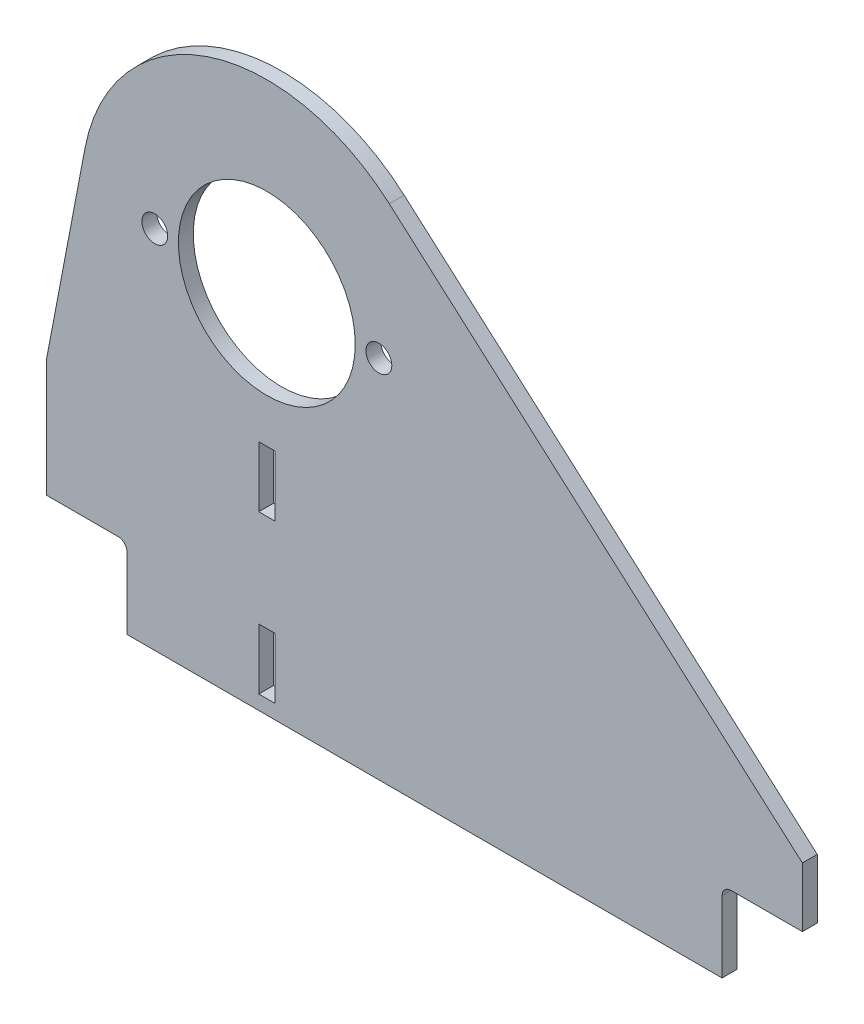
from build123d import *

# Parameters (mm, degrees)
SKETCH_1_R             = 4.35
SKETCH_1_R_2           = 29.732137495
SM_BASE_FLANGE_1_DEPTH = 5
OTHER_START            = -2.7
OTHER_1_OUTLINE_W      = 20.4
OTHER_1_OUTLINE_H      = 5
OTHER_1_DEPTH          = 5.4


# Read off the part's stored shape, not the designer's step: Выступы и прорези-Прорезь1
# Sheet-metal steps are written as plain solids
with BuildPart() as part:
    # Sketch 1 → Базовая кромка1 (new body)
    with BuildSketch(Plane.XY):
        with BuildLine():
            Line((153.076706029, -3), (153.076706029, -27))
            Line((153.076706029, -27), (-47, -27))
            Line((-47, -27), (-47, -3))
            ThreePointArc((-47, -3), (-47.878679656, -0.878679656), (-50, 0))
            Line((-50, 0), (-74, 0))
            Line((-74, 0), (-74, 40))
            Line((-74, 40), (-61.150039911, 107.459829597))
            ThreePointArc((-61.150039911, 107.459829597), (-20.166822902, 154.704084341), (41.173899677, 142.499190395))
            Line((41.173899677, 142.499190395), (180.076706029, 20))
            Line((180.076706029, 20), (180.076706029, 0))
            Line((180.076706029, 0), (156.076706029, 0))
            ThreePointArc((156.076706029, 0), (153.955385686, -0.878679656), (153.076706029, -3))
        make_face()
        with Locations((-37.675, 95.811778053)):
            Circle(SKETCH_1_R, mode=Mode.SUBTRACT)
        with Locations((37.675, 95.811778053)):
            Circle(SKETCH_1_R, mode=Mode.SUBTRACT)
        with Locations((0, 95.811778053)):
            Circle(SKETCH_1_R_2, mode=Mode.SUBTRACT)
    extrude(amount=-SM_BASE_FLANGE_1_DEPTH)

    # Other 1 outline → Other 1 (cut)
    with BuildSketch(Plane.YZ.offset(OTHER_START)):
        with Locations((41.079640558, -2.5)):
            Rectangle(OTHER_1_OUTLINE_W, OTHER_1_OUTLINE_H)
        with Locations((-12, -2.5)):
            Rectangle(OTHER_1_OUTLINE_W, OTHER_1_OUTLINE_H)
    extrude(amount=OTHER_1_DEPTH, mode=Mode.SUBTRACT)


solid = part.part
